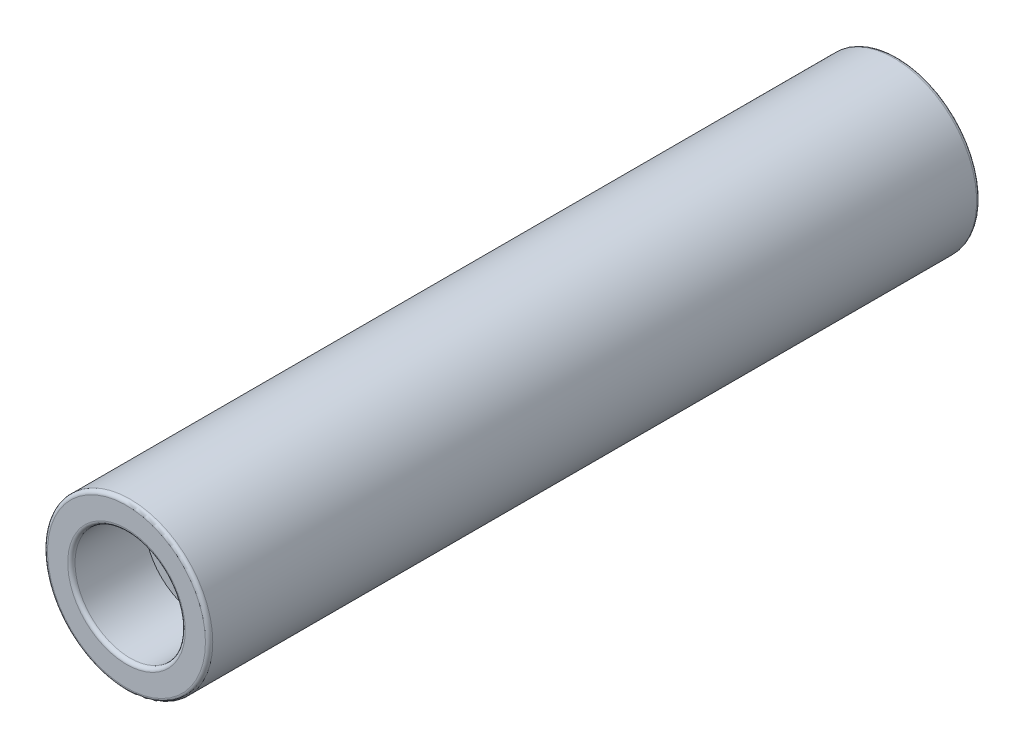
from build123d import *

# Parameters (mm, degrees)
SKETCH1_R           = 4.5
SKETCH1_R_2         = 1.5
EXTRUDE_THIN1_DEPTH = 12
SKETCH11_R          = 4.5
SKETCH11_R_2        = 1.5
EXTRUDE_THIN3_DEPTH = 5
SKETCH12_R          = 4.5
SKETCH12_R_2        = 3
EXTRUDE_THIN4_DEPTH = 4
THREAD1_PITCH       = 0.5
FILLET2_R           = 0.2


with BuildPart() as part:
    # Sketch1 → Extrude-Thin1 (new body)
    with BuildSketch(Plane.XY):
        Circle(SKETCH1_R)
        Circle(SKETCH1_R_2, mode=Mode.SUBTRACT)
    extrude_thin1 = extrude(amount=EXTRUDE_THIN1_DEPTH)

    # Sketch11 → Extrude-Thin3 (add)
    with BuildSketch(Plane.XY.offset(12)):
        Circle(SKETCH11_R)
        Circle(SKETCH11_R_2, mode=Mode.SUBTRACT)
    extrude_thin3 = extrude(amount=EXTRUDE_THIN3_DEPTH)

    # Sketch12 → Extrude-Thin4 (add)
    with BuildSketch(Plane.XY.offset(17)):
        Circle(SKETCH12_R)
        Circle(SKETCH12_R_2, mode=Mode.SUBTRACT)
    extrude_thin4 = extrude(amount=EXTRUDE_THIN4_DEPTH)

    # Thread1: the profile of Thread Profile1 profile screwed along a right-hand helix of 10 turns, 6 arcs to a turn; built about Z, then put on its axis
    thread1_z = Axis((0, 0, 0), (0, 0, 1))
    thread1_corners = [(1.5003, 0, -0.000173205), (1.5003, 0, 0.437673204), (1.229367062, 0, 0.281249999), (1.229367062, 0, 0.156249999)]
    with BuildLine(mode=Mode.PRIVATE) as thread1_profile:
        Line(thread1_corners[0], thread1_corners[1])
        Line(thread1_corners[1], thread1_corners[2])
        Line(thread1_corners[2], thread1_corners[3])
        Line(thread1_corners[3], thread1_corners[0])
    thread1_cap = Face(thread1_profile.wire())
    thread1_turn_angles = [0, 30, 60, 90, 120, 150, 180, 210, 240, 270, 300, 330, 360]
    thread1_turn_weights = [1, 0.8660254037844387, 1, 0.8660254037844387, 1, 0.8660254037844387, 1, 0.8660254037844387, 1, 0.8660254037844387, 1, 0.8660254037844387, 1]
    thread1_turn_rails = [Edge.make_bspline([Vector(p[0], p[1], 0).rotate(thread1_z, thread1_turn_angles[k]) / thread1_turn_weights[k] + Vector(0, 0, p[2] + THREAD1_PITCH * thread1_turn_angles[k] / 360) for k in range(13)], [0, 0, 0, 1, 1, 2, 2, 3, 3, 4, 4, 5, 5, 6, 6, 6], 2, thread1_turn_weights) for p in thread1_corners]
    thread1_turn_sides = [Face.make_surface_from_curves(thread1_turn_rails[p[0]], thread1_turn_rails[p[1]]) for p in [(0, 1), (1, 2), (2, 3), (3, 0)]]
    thread1 = Plane(origin=(0, 0, 17), x_dir=(-1, 0, 0), z_dir=(0, 0, -1)) * Solid(Shell([*[p.moved(Location((0, 0, THREAD1_PITCH * i))) for i in range(10) for p in thread1_turn_sides], thread1_cap, thread1_cap.rotate(thread1_z, 3600).moved(Location((0, 0, THREAD1_PITCH * 3600 / 360)))]))
    add(thread1)

    # Mirror2: Extrude-Thin1, Extrude-Thin3, Extrude-Thin4, Thread1 across plane
    add(extrude_thin1.mirror(Plane.XY))
    add(extrude_thin3.mirror(Plane.XY))
    add(extrude_thin4.mirror(Plane.XY))
    add(thread1.mirror(Plane.XY))

    # Fillet2
    fillet2_edges = [part.edges().sort_by_distance(p)[0] for p in [
        (-4.5, 0, 21),
        (-3, 0, 21),
        (-4.5, 0, -21),
        (-3, 0, -21),
    ]]
    fillet(fillet2_edges, radius=FILLET2_R)


solid = part.part
